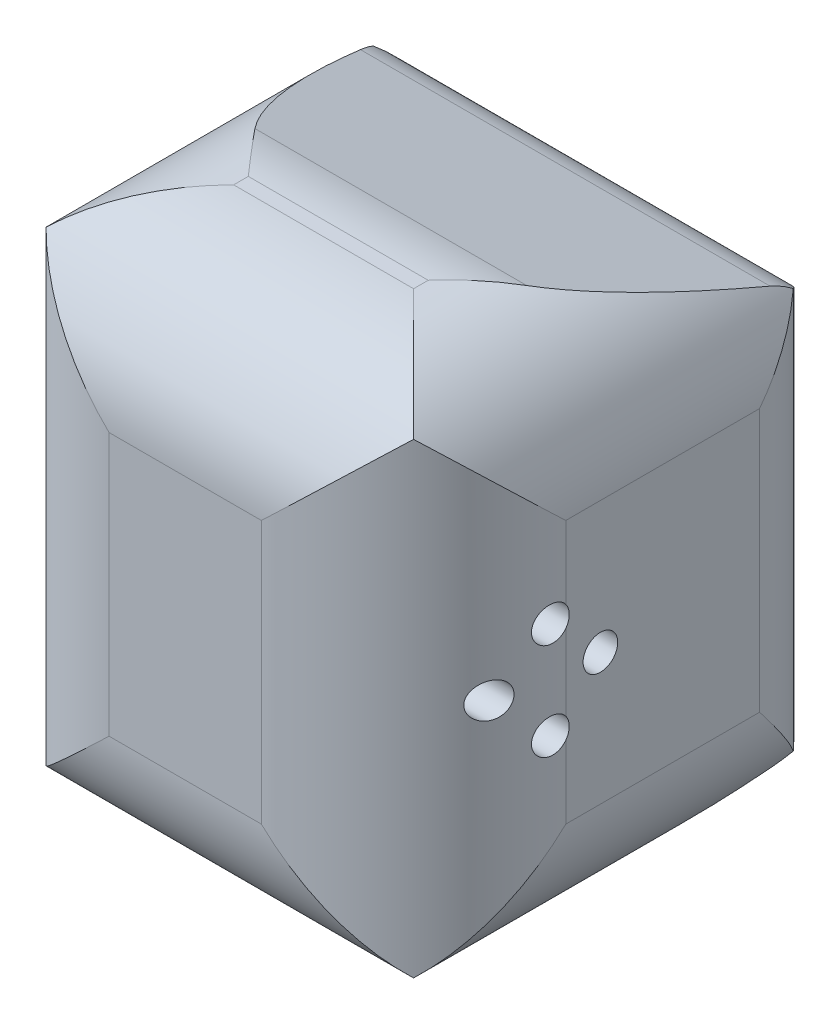
from build123d import *

# Parameters (mm, degrees)
BOSS_1_DEPTH    = 66
CUT_2_DEPTH     = 80
CUT_3_DEPTH     = 80
CUT_4_DEPTH     = 80
CUT_5_DEPTH     = 80
CUT_6_DEPTH     = 62.2
CUT_7_DEPTH     = 62.2
CUT_8_DEPTH     = 62.2
CUT_9_DEPTH     = 62.2
S_CUT10_W       = 52.00000000000001
S_CUT10_H       = 48
POCKET_10_DEPTH = 16.200000000000003
S_CUT11_W       = 52.00000000000001
S_CUT11_H       = 60.00000000000001
POCKET_11_DEPTH = 36.00000000000001
S_CUT12_W       = 36.00000000000001
S_CUT12_H       = 48
POCKET_12_DEPTH = 6.100000000000001
S_CUT13_W       = 7.200000000000006
S_CUT13_H       = 32
POCKET_13_DEPTH = 28
S_HOLE14_R      = 2.500000000000002
HOLE_14_DEPTH   = 7.200000000000003
S_HOLE15_R      = 2.500000000000002
HOLE_15_DEPTH   = 7.200000000000003
S_HOLE16_R      = 2.500000000000002
HOLE_16_DEPTH   = 7.200000000000003
S_HOLE17_R      = 2.500000000000002
HOLE_17_DEPTH   = 7.200000000000003
S_HOLE18_R      = 1.1999999999999997
HOLE_18_DEPTH   = 7.200000000000003
S_HOLE19_R      = 2.3
HOLE_19_DEPTH   = 2
S_HOLE20_R      = 1.1999999999999997
HOLE_20_DEPTH   = 7.200000000000003
S_HOLE21_R      = 2.3
HOLE_21_DEPTH   = 2


with BuildPart() as part:
    # S_prism1 → Boss_1 (new body)
    with BuildSketch(Plane(origin=(-33, 0, 0), x_dir=(0, 0, -1), z_dir=(1, 0, 0))):
        with BuildLine():
            Line((0, -20.5991), (0, 20.5991))
            ThreePointArc((0, 20.5991), (-1.9619006519921314, 26.548000880978933), (-7.077800000000001, 30.1627))
            Line((-7.077800000000001, 30.1627), (-32.2859, 37.8651))
            ThreePointArc((-32.2859, 37.8651), (-36.04260399370441, 38.71470059655654), (-39.88360000000001, 39))
            Line((-39.88360000000001, 39), (-42, 39))
            ThreePointArc((-42, 39), (-56.1421, 33.1421), (-62, 19))
            Line((-62, 19), (-62, -19))
            ThreePointArc((-62, -19), (-56.1421, -33.1421), (-42, -39))
            Line((-42, -39), (-39.88360000000001, -39))
            ThreePointArc((-39.88360000000001, -39), (-36.04260399370441, -38.71470059655654), (-32.2859, -37.8651))
            Line((-32.2859, -37.8651), (-7.077800000000001, -30.1627))
            ThreePointArc((-7.077800000000001, -30.1627), (-1.9619006519921331, -26.54800088097893), (0, -20.5991))
        make_face()
    extrude(amount=BOSS_1_DEPTH)

    # S_pcut2 → Cut_2 (cut)
    with BuildSketch(Plane(origin=(0, -40, 0), x_dir=(1, 0, 0), z_dir=(0, 1, 0))):
        with BuildLine():
            Line((33.6, -62.6), (11, -62.6))
            Line((11, -62.6), (11, -62))
            ThreePointArc((11, -62), (26.556300000000007, -55.5563), (33, -40))
            Line((33, -40), (33.6, -40))
            Line((33.6, -40), (33.6, -62.6))
        make_face()
    extrude(amount=CUT_2_DEPTH, mode=Mode.SUBTRACT)

    # S_pcut3 → Cut_3 (cut)
    with BuildSketch(Plane(origin=(0, -40, 0), x_dir=(1, 0, 0), z_dir=(0, 1, 0))):
        with BuildLine():
            Line((-33.6, -62.6), (-11, -62.6))
            Line((-11, -62.6), (-11, -62))
            ThreePointArc((-11, -62), (-26.556300000000007, -55.5563), (-33, -40))
            Line((-33, -40), (-33.6, -40))
            Line((-33.6, -40), (-33.6, -62.6))
        make_face()
    extrude(amount=CUT_3_DEPTH, mode=Mode.SUBTRACT)

    # S_pcut4 → Cut_4 (cut)
    with BuildSketch(Plane(origin=(0, -40, 0), x_dir=(1, 0, 0), z_dir=(0, 1, 0))):
        with BuildLine():
            Line((33.6, 0.6), (21, 0.6))
            Line((21, 0.6), (21, 0))
            ThreePointArc((21, 0), (29.4853, -3.514700000000003), (33, -12))
            Line((33, -12), (33.6, -12))
            Line((33.6, -12), (33.6, 0.6))
        make_face()
    extrude(amount=CUT_4_DEPTH, mode=Mode.SUBTRACT)


with BuildPart() as cut_4_kept_piece:
    # of the separate pieces the step leaves, the one the design keeps (cut_4_pieces_kept)
    add(part.part.solids().sort_by_distance((-33, -30.1627, 7.0778))[0])

    # S_pcut5 → Cut_5 (cut)
    with BuildSketch(Plane(origin=(0, -40, 0), x_dir=(1, 0, 0), z_dir=(0, 1, 0))):
        with BuildLine():
            Line((-33.6, 0.6), (-21, 0.6))
            Line((-21, 0.6), (-21, 0))
            ThreePointArc((-21, 0), (-29.4853, -3.514700000000003), (-33, -12))
            Line((-33, -12), (-33.6, -12))
            Line((-33.6, -12), (-33.6, 0.6))
        make_face()
    extrude(amount=CUT_5_DEPTH, mode=Mode.SUBTRACT)

    # S_pcut6 → Cut_6 (cut)
    with BuildSketch(Plane.XY.offset(-0.1)):
        with BuildLine():
            Line((33.6, 39.6), (13.000000000000002, 39.6))
            Line((13.000000000000002, 39.6), (13.000000000000002, 39))
            ThreePointArc((13.000000000000002, 39), (27.1421, 33.1421), (33, 19))
            Line((33, 19), (33.6, 19))
            Line((33.6, 19), (33.6, 39.6))
        make_face()
    extrude(amount=CUT_6_DEPTH, mode=Mode.SUBTRACT)

    # S_pcut7 → Cut_7 (cut)
    with BuildSketch(Plane.XY.offset(-0.1)):
        with BuildLine():
            Line((33.6, -39.6), (13.000000000000002, -39.6))
            Line((13.000000000000002, -39.6), (13.000000000000002, -39))
            ThreePointArc((13.000000000000002, -39), (27.1421, -33.1421), (33, -19))
            Line((33, -19), (33.6, -19))
            Line((33.6, -19), (33.6, -39.6))
        make_face()
    extrude(amount=CUT_7_DEPTH, mode=Mode.SUBTRACT)

    # S_pcut8 → Cut_8 (cut)
    with BuildSketch(Plane.XY.offset(-0.1)):
        with BuildLine():
            Line((-33.6, 39.6), (-13.000000000000002, 39.6))
            Line((-13.000000000000002, 39.6), (-13.000000000000002, 39))
            ThreePointArc((-13.000000000000002, 39), (-27.142100000000003, 33.14209999999999), (-33, 19))
            Line((-33, 19), (-33.6, 19))
            Line((-33.6, 19), (-33.6, 39.6))
        make_face()
    extrude(amount=CUT_8_DEPTH, mode=Mode.SUBTRACT)

    # S_pcut9 → Cut_9 (cut)
    with BuildSketch(Plane.XY.offset(-0.1)):
        with BuildLine():
            Line((-33.6, -39.6), (-13.000000000000002, -39.6))
            Line((-13.000000000000002, -39.6), (-13.000000000000002, -39))
            ThreePointArc((-13.000000000000002, -39), (-27.142100000000003, -33.14209999999999), (-33, -19))
            Line((-33, -19), (-33.6, -19))
            Line((-33.6, -19), (-33.6, -39.6))
        make_face()
    extrude(amount=CUT_9_DEPTH, mode=Mode.SUBTRACT)

    # S_cut10 → Pocket_10 (cut)
    with BuildSketch(Plane.XY.offset(-0.1)):
        Rectangle(S_CUT10_W, S_CUT10_H)
    extrude(amount=POCKET_10_DEPTH, mode=Mode.SUBTRACT)

    # S_cut11 → Pocket_11 (cut)
    with BuildSketch(Plane.XY.offset(16)):
        Rectangle(S_CUT11_W, S_CUT11_H)
    extrude(amount=POCKET_11_DEPTH, mode=Mode.SUBTRACT)

    # S_cut12 → Pocket_12 (cut)
    with BuildSketch(Plane.XY.offset(51.9)):
        Rectangle(S_CUT12_W, S_CUT12_H)
    extrude(amount=POCKET_12_DEPTH, mode=Mode.SUBTRACT)

    # S_cut13 → Pocket_13 (cut)
    with BuildSketch(Plane.XY.offset(16)):
        with Locations((-29.5, 0)):
            Rectangle(S_CUT13_W, S_CUT13_H)
    extrude(amount=POCKET_13_DEPTH, mode=Mode.SUBTRACT)

    # S_hole14 → Hole_14 (cut)
    with BuildSketch(Plane(origin=(25.9, 0, 0), x_dir=(0, 0, -1), z_dir=(1, 0, 0))):
        with Locations((-49, 0)):
            Circle(S_HOLE14_R)
    extrude(amount=HOLE_14_DEPTH, mode=Mode.SUBTRACT)

    # S_hole15 → Hole_15 (cut)
    with BuildSketch(Plane(origin=(25.9, 0, 0), x_dir=(0, 0, -1), z_dir=(1, 0, 0))):
        with Locations((-42, 7)):
            Circle(S_HOLE15_R)
    extrude(amount=HOLE_15_DEPTH, mode=Mode.SUBTRACT)

    # S_hole16 → Hole_16 (cut)
    with BuildSketch(Plane(origin=(25.9, 0, 0), x_dir=(0, 0, -1), z_dir=(1, 0, 0))):
        with Locations((-42, -7)):
            Circle(S_HOLE16_R)
    extrude(amount=HOLE_16_DEPTH, mode=Mode.SUBTRACT)

    # S_hole17 → Hole_17 (cut)
    with BuildSketch(Plane(origin=(25.9, 0, 0), x_dir=(0, 0, -1), z_dir=(1, 0, 0))):
        with Locations((-35, 0)):
            Circle(S_HOLE17_R)
    extrude(amount=HOLE_17_DEPTH, mode=Mode.SUBTRACT)

    # S_hole18 → Hole_18 (cut)
    with BuildSketch(Plane(origin=(-33.1, 0, 0), x_dir=(0, 0, -1), z_dir=(1, 0, 0))):
        with Locations((-8, -10)):
            Circle(S_HOLE18_R)
    extrude(amount=HOLE_18_DEPTH, mode=Mode.SUBTRACT)

    # S_hole19 → Hole_19 (cut)
    with BuildSketch(Plane(origin=(-33.1, 0, 0), x_dir=(0, 0, -1), z_dir=(1, 0, 0))):
        with Locations((-8, -10)):
            Circle(S_HOLE19_R)
    extrude(amount=HOLE_19_DEPTH, mode=Mode.SUBTRACT)

    # S_hole20 → Hole_20 (cut)
    with BuildSketch(Plane(origin=(-33.1, 0, 0), x_dir=(0, 0, -1), z_dir=(1, 0, 0))):
        with Locations((-8, 10)):
            Circle(S_HOLE20_R)
    extrude(amount=HOLE_20_DEPTH, mode=Mode.SUBTRACT)

    # S_hole21 → Hole_21 (cut)
    with BuildSketch(Plane(origin=(-33.1, 0, 0), x_dir=(0, 0, -1), z_dir=(1, 0, 0))):
        with Locations((-8, 10)):
            Circle(S_HOLE21_R)
    extrude(amount=HOLE_21_DEPTH, mode=Mode.SUBTRACT)


solid = cut_4_kept_piece.part
